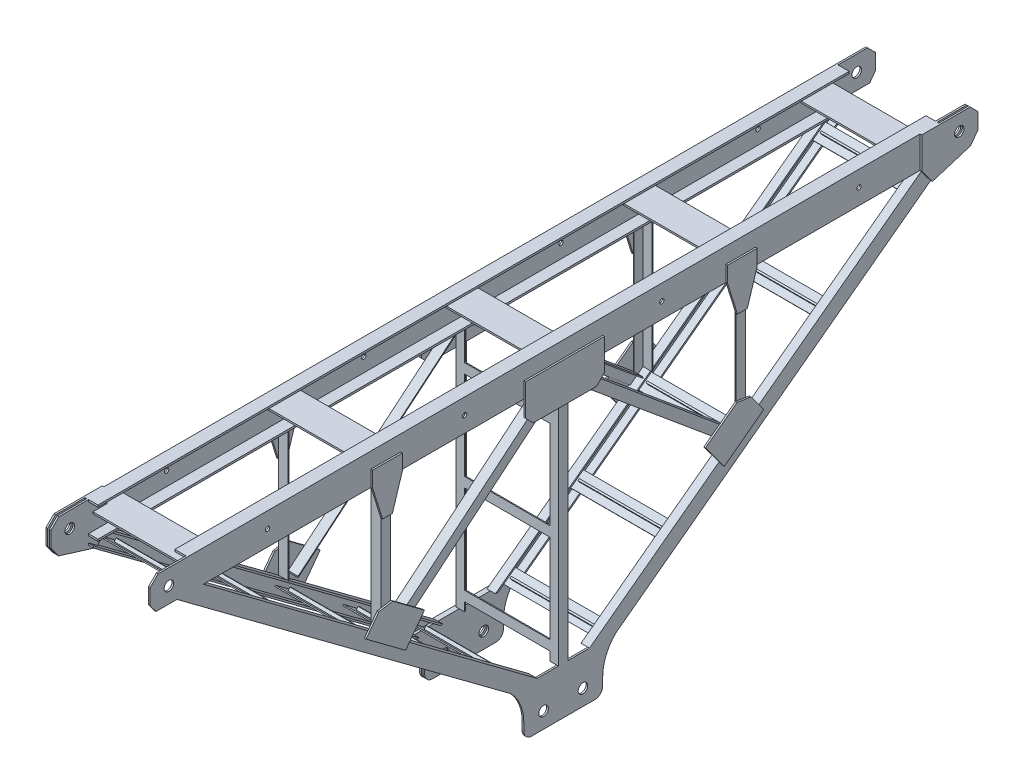
from build123d import *

# Parameters (mm, degrees)
EXTRUDE_1_DEPTH           = 4190
EXTRUDE_1_2_DEPTH         = 4190
SKETCH_7_W                = 400
SKETCH_7_H                = 240
EXTRUDE_4_DEPTH           = 520
SKETCH_8_W                = 503
SKETCH_8_H                = 400
CUT_EXTRUDE_5_DEPTH       = 4455.537012979
SKETCH_9_R                = 11
CUT_EXTRUDE_6_DEPTH       = 4481.68075185
EXTRUDE_8_DEPTH           = 43
EXTRUDE_8_2_DEPTH         = 43
CUT_EXTRUDE_9_DEPTH       = 38
EXTRUDE_10_DEPTH          = 43
EXTRUDE_10_2_DEPTH        = 43
CUT_EXTRUDE_11_DEPTH      = 38
SKETCH_17_W               = 50
SKETCH_17_H               = 1260
EXTRUDE_12_DEPTH          = 520
EXTRUDE_12_2_DEPTH        = 520
EXTRUDE_12_3_DEPTH        = 520
CUT_EXTRUDE_13_DEPTH      = 1260
SKETCH_22_W               = 390
SKETCH_22_H               = 1000
CUT_EXTRUDE_14_DEPTH      = 3412.861661908
SKETCH_23_W               = 50
SKETCH_23_H               = 707.63301644
CUT_EXTRUDE_15_DEPTH      = 15
SKETCH_25_W               = 50
SKETCH_25_H               = 707.63301644
CUT_EXTRUDE_16_DEPTH      = 15
CUT_EXTRUDE_17_DEPTH      = 45
CUT_EXTRUDE_18_DEPTH      = 45
EXTRUDE_19_DEPTH          = 50
CUT_EXTRUDE_20_DEPTH      = 45
EXTRUDE_21_DEPTH          = 50
CUT_EXTRUDE_22_DEPTH      = 45
SKETCH_32_W               = 400
SKETCH_32_H               = 200
EXTRUDE_23_DEPTH          = 8.5
PATTERN_LINEAR_7_COUNT    = 2
PATTERN_LINEAR_7_PITCH    = 528.5
EXTRUDE_24_DEPTH          = 520
PATTERN_LINEAR_8_COUNT    = 5
PATTERN_LINEAR_8_PITCH    = 900
EXTRUDE_25_DEPTH          = 512
SKETCH_35_W               = 440
SKETCH_35_H               = 8.5
EXTRUDE_26_DEPTH          = 15
PATTERN_LINEAR_9_COUNT    = 3
PATTERN_LINEAR_9_PITCH    = 430
PATTERN_LINEAR_10_COUNT   = 3
PATTERN_LINEAR_10_PITCH   = 550
MIRROR_13_COPY_1_DEPTH    = 512
MIRROR_13_COPY_2_DEPTH    = 512
MIRROR_13_COPY_3_SKETCH_W = 440
MIRROR_13_COPY_3_SKETCH_H = 8.5
MIRROR_13_COPY_3_DEPTH    = 15
MIRROR_13_COPY_4_SKETCH_W = 440
MIRROR_13_COPY_4_SKETCH_H = 8.5
MIRROR_13_COPY_4_DEPTH    = 15
MIRROR_13_COPY_5_DEPTH    = 512
MIRROR_13_COPY_6_DEPTH    = 512
MIRROR_13_COPY_7_SKETCH_W = 440
MIRROR_13_COPY_7_SKETCH_H = 8.5
MIRROR_13_COPY_7_DEPTH    = 15
MIRROR_13_COPY_8_SKETCH_W = 440
MIRROR_13_COPY_8_SKETCH_H = 8.5
MIRROR_13_COPY_8_DEPTH    = 15
SKETCH_36_W               = 50
SKETCH_36_H               = 50
EXTRUDE_27_DEPTH          = 520
SKETCH_37_W               = 510
SKETCH_37_H               = 45
CUT_EXTRUDE_28_DEPTH      = 45
PATTERN_LINEAR_11_COUNT   = 2
PATTERN_LINEAR_11_PITCH   = 500
PATTERN_LINEAR_13_COUNT   = 2
PATTERN_LINEAR_13_PITCH   = 500
SKETCH_38_W               = 503
SKETCH_38_H               = 190
CUT_EXTRUDE_29_DEPTH      = 4538.732060182
EXTRUDE_30_DEPTH          = 8.5
PATTERN_LINEAR_14_COUNT   = 2
PATTERN_LINEAR_14_PITCH   = 17
SKETCH_41_W               = 8.5
SKETCH_41_H               = 190
CUT_EXTRUDE_31_DEPTH      = 4538.732060182
SKETCH_42_R               = 24.25
CUT_EXTRUDE_32_DEPTH      = 4483.68546744
EXTRUDE_33_DEPTH          = 8.5
PATTERN_LINEAR_15_COUNT   = 2
PATTERN_LINEAR_15_PITCH   = 17
SKETCH_44_W               = 8.5
SKETCH_44_H               = 190
CUT_EXTRUDE_34_DEPTH      = 160
SKETCH_45_R               = 24.25
CUT_EXTRUDE_35_DEPTH      = 4483.68546744
CHAMFER_1_SIZE            = 50
EXTRUDE_37_DEPTH          = 8.5
PATTERN_LINEAR_16_COUNT   = 3
PATTERN_LINEAR_16_PITCH   = 8.5
SKETCH_48_W               = 8.5
SKETCH_48_H               = 600
CUT_EXTRUDE_38_DEPTH      = 160
EXTRUDE_39_DEPTH          = 8.5
FILLET_2_R                = 40
SKETCH_50_R               = 24.25
CUT_EXTRUDE_40_DEPTH      = 4483.68546744
SKETCH_51_W               = 494.5
SKETCH_51_H               = 1000
CUT_EXTRUDE_41_DEPTH      = 4456.537257167
CHAMFER_2_SIZE            = 40
SKETCH_52_R               = 11
CUT_EXTRUDE_42_DEPTH      = 4482.675161142
PATTERN_LINEAR_17_COUNT   = 4
PATTERN_LINEAR_17_PITCH   = 1000
CUT_EXTRUDE_43_DEPTH      = 4483.68546744


with BuildPart() as part:
    # 草图2 → 拉伸1 (new body)
    with BuildSketch(Plane.XY):
        Polygon((0, 0), (0, 160), (65, 160), (65, 150), (8.5, 150), (8.5, 10), (65, 10), (65, 0), align=None)
    extrude(amount=EXTRUDE_1_DEPTH)



with BuildPart() as body_2:
    # 草图2 → Extrude 1 2 (new body)
    with BuildSketch(Plane.XY):
        Polygon((455, 160), (520, 160), (520, 0), (455, 0), (455, 10), (511.5, 10), (511.5, 150), (455, 150), align=None)
    extrude(amount=EXTRUDE_1_2_DEPTH)



with BuildPart() as body_3:
    # 草图7 → 拉伸4 (new body)
    with BuildSketch(Plane(origin=(520, 0, 0), x_dir=(0, 0, -1), z_dir=(1, 0, 0))):
        with Locations((-2095, -1380)):
            Rectangle(SKETCH_7_W, SKETCH_7_H)
    extrude(amount=-EXTRUDE_4_DEPTH)

    # 草图8 → 拉伸5 (cut, through all)
    with BuildSketch(Plane(origin=(0, -1260, 0), x_dir=(1, 0, 0), z_dir=(0, 1, 0))):
        with Locations((260, -2095)):
            Rectangle(SKETCH_8_W, SKETCH_8_H)
    extrude(amount=-CUT_EXTRUDE_5_DEPTH, mode=Mode.SUBTRACT)


with BuildPart() as cut_extrude_5_piece_1:
    # of the separate pieces the step leaves, piece 1, a body of its own (cut_extrude_5_pieces)
    add(body_3.part.solids().sort_by_distance((8.5, -1260, 2295))[0])


with BuildPart() as cut_extrude_5_piece_2:
    # of the separate pieces the step leaves, piece 2, a body of its own (cut_extrude_5_pieces)
    add(body_3.part.solids().sort_by_distance((520, -1260, 2295))[0])


with BuildPart() as cut_extrude_6_tool:
    # 草图9 → 拉伸6 (new, through all)
    with BuildSketch(Plane(origin=(520, 0, 0), x_dir=(0, 0, -1), z_dir=(1, 0, 0))):
        with Locations((-2195, -1420)):
            Circle(SKETCH_9_R)
        with Locations((-1995, -1420)):
            Circle(SKETCH_9_R)
    extrude(amount=-CUT_EXTRUDE_6_DEPTH)


with BuildPart() as cut_extrude_5_piece_1_1:
    add(cut_extrude_5_piece_1.part)

    # 拉伸6: cut by cut_extrude_6_tool
    add(cut_extrude_6_tool.part, mode=Mode.SUBTRACT)


with BuildPart() as cut_extrude_5_piece_2_1:
    add(cut_extrude_5_piece_2.part)

    # 拉伸6: cut by cut_extrude_6_tool
    add(cut_extrude_6_tool.part, mode=Mode.SUBTRACT)


with BuildPart() as body_5:
    # 草图13 → 拉伸8 (new body)
    with BuildSketch(Plane(origin=(520, 0, 0), x_dir=(0, 0, -1), z_dir=(1, 0, 0))):
        Polygon((-1961.985500305, -1260), (-1895, -1260), (-1895, -1309.86698356), (-135.477186263, 0), (-269.448186872, 0), align=None)
    extrude(amount=-EXTRUDE_8_DEPTH)


with BuildPart() as body_6:
    # 草图13 → Extrude 8 2 (new body)
    with BuildSketch(Plane(origin=(520, 0, 0), x_dir=(0, 0, -1), z_dir=(1, 0, 0))):
        Polygon((-2228.014499695, -1260), (-2295, -1260), (-2295, -1309.86698356), (-4054.522813737, 0), (-3920.551813128, 0), align=None)
    extrude(amount=-EXTRUDE_8_2_DEPTH)


with BuildPart() as cut_extrude_9_tool:
    # 草图14 → 拉伸9 (new body)
    with BuildSketch(Plane.ZY.offset(-477)):
        Polygon((3933.948913189, 0), (4041.125713677, 0), (2295, -1299.893586848), (2295, -1260), (2241.411599756, -1260), align=None)
        Polygon((148.874286323, 0), (256.051086811, 0), (1948.588400244, -1260), (1895, -1260), (1895, -1299.893586848), align=None)
    extrude(amount=-CUT_EXTRUDE_9_DEPTH)


with BuildPart() as body_5_1:
    add(body_5.part)

    # 拉伸9: cut by cut_extrude_9_tool
    add(cut_extrude_9_tool.part, mode=Mode.SUBTRACT)


with BuildPart() as body_6_1:
    add(body_6.part)

    # 拉伸9: cut by cut_extrude_9_tool
    add(cut_extrude_9_tool.part, mode=Mode.SUBTRACT)


with BuildPart() as body_7:
    # 草图15 → 拉伸10 (new body)
    with BuildSketch(Plane.ZY):
        Polygon((3920.551813128, 0), (4054.522813737, 0), (2295, -1309.86698356), (2295, -1260), (2228.014499695, -1260), align=None)
    extrude(amount=-EXTRUDE_10_DEPTH)


with BuildPart() as body_8:
    # 草图15 → Extrude 10 2 (new body)
    with BuildSketch(Plane.ZY):
        Polygon((135.477186263, 0), (269.448186872, 0), (1961.985500305, -1260), (1895, -1260), (1895, -1309.86698356), align=None)
    extrude(amount=-EXTRUDE_10_2_DEPTH)


with BuildPart() as cut_extrude_11_tool:
    # 草图16 → 拉伸11 (new body)
    with BuildSketch(Plane(origin=(43, 0, 0), x_dir=(0, 0, -1), z_dir=(1, 0, 0))):
        Polygon((-3933.948913189, 0), (-4041.125713677, 0), (-2295, -1299.893586848), (-2295, -1260), (-2241.411599756, -1260), align=None)
        Polygon((-256.051086811, 0), (-148.874286323, 0), (-1895, -1299.893586848), (-1895, -1260), (-1948.588400244, -1260), align=None)
    extrude(amount=-CUT_EXTRUDE_11_DEPTH)


with BuildPart() as body_7_1:
    add(body_7.part)

    # 拉伸11: cut by cut_extrude_11_tool
    add(cut_extrude_11_tool.part, mode=Mode.SUBTRACT)


with BuildPart() as body_8_1:
    add(body_8.part)

    # 拉伸11: cut by cut_extrude_11_tool
    add(cut_extrude_11_tool.part, mode=Mode.SUBTRACT)


with BuildPart() as body_9:
    # 草图17 → 拉伸12 (new body)
    with BuildSketch(Plane.ZY):
        with Locations((2095, -630)):
            Rectangle(SKETCH_17_W, SKETCH_17_H)
    extrude(amount=-EXTRUDE_12_DEPTH)

    # 草图18 → 拉伸13 (cut)
    with BuildSketch(Plane.XZ.offset(1260)):
        Polygon((5, 2115), (43, 2115), (43, 2120), (477, 2120), (477, 2115), (515, 2115), (515, 2070), (5, 2070), align=None)
    extrude(amount=-CUT_EXTRUDE_13_DEPTH, mode=Mode.SUBTRACT)


with BuildPart() as body_10:
    # 草图17 → Extrude 12 2 (new body)
    with BuildSketch(Plane.ZY):
        Polygon((2970, 0), (2970, -707.63301644), (3020, -670.410794218), (3020, 0), align=None)
    extrude(amount=-EXTRUDE_12_2_DEPTH)


with BuildPart() as body_11:
    # 草图17 → Extrude 12 3 (new body)
    with BuildSketch(Plane.ZY):
        Polygon((1170, 0), (1170, -670.410794218), (1220, -707.63301644), (1220, 0), align=None)
    extrude(amount=-EXTRUDE_12_3_DEPTH)


with BuildPart() as cut_extrude_13_piece_1:
    # of the separate pieces the step leaves, piece 1, a body of its own (cut_extrude_13_pieces)
    add(body_9.part.solids().sort_by_distance((515, 0, 2115))[0])


with BuildPart() as cut_extrude_13_piece_2:
    # of the separate pieces the step leaves, piece 2, a body of its own (cut_extrude_13_pieces)
    add(body_9.part.solids().sort_by_distance((0, 0, 2070))[0])


with BuildPart() as cut_extrude_14_tool:
    # 草图22 → 拉伸14 (new, through all)
    with BuildSketch(Plane.XY.offset(3020)):
        with Locations((260, -500)):
            Rectangle(SKETCH_22_W, SKETCH_22_H)
    extrude(amount=-CUT_EXTRUDE_14_DEPTH)


with BuildPart() as body_10_1:
    add(body_10.part)

    # 拉伸14: cut by cut_extrude_14_tool
    add(cut_extrude_14_tool.part, mode=Mode.SUBTRACT)


with BuildPart() as body_11_1:
    add(body_11.part)

    # 拉伸14: cut by cut_extrude_14_tool
    add(cut_extrude_14_tool.part, mode=Mode.SUBTRACT)


with BuildPart() as cut_extrude_14_piece_1:
    # of the separate pieces the step leaves, piece 1, a body of its own (cut_extrude_14_pieces)
    add(body_10_1.part.solids().sort_by_distance((0, 0, 2970))[0])


with BuildPart() as cut_extrude_14_piece_2:
    # of the separate pieces the step leaves, piece 2, a body of its own (cut_extrude_14_pieces)
    add(body_10_1.part.solids().sort_by_distance((455, -707.63301644, 2970))[0])


with BuildPart() as cut_extrude_14_piece_1_of_body_11:
    # of the separate pieces the step leaves, piece 1, a body of its own (cut_extrude_14_pieces_of_body_11)
    add(body_11_1.part.solids().sort_by_distance((0, 0, 1170))[0])


with BuildPart() as cut_extrude_14_piece_2_of_body_11:
    # of the separate pieces the step leaves, piece 2, a body of its own (cut_extrude_14_pieces_of_body_11)
    add(body_11_1.part.solids().sort_by_distance((455, -670.410794218, 1170))[0])


with BuildPart() as cut_extrude_15_tool:
    # 草图23 → 拉伸15 (new body)
    with BuildSketch(Plane.ZY.offset(-455)):
        with Locations((1195, -353.81650822)):
            Rectangle(SKETCH_23_W, SKETCH_23_H)
        with Locations((2995, -353.81650822)):
            Rectangle(SKETCH_23_W, SKETCH_23_H)
    extrude(amount=-CUT_EXTRUDE_15_DEPTH)


with BuildPart() as cut_extrude_14_piece_2_1:
    add(cut_extrude_14_piece_2.part)

    # 拉伸15: cut by cut_extrude_15_tool
    add(cut_extrude_15_tool.part, mode=Mode.SUBTRACT)


with BuildPart() as cut_extrude_14_piece_2_of_body_11_1:
    add(cut_extrude_14_piece_2_of_body_11.part)

    # 拉伸15: cut by cut_extrude_15_tool
    add(cut_extrude_15_tool.part, mode=Mode.SUBTRACT)


with BuildPart() as cut_extrude_16_tool:
    # 草图25 → 拉伸16 (new body)
    with BuildSketch(Plane(origin=(65, 0, 0), x_dir=(0, 0, -1), z_dir=(1, 0, 0))):
        with Locations((-2995, -353.81650822)):
            Rectangle(SKETCH_25_W, SKETCH_25_H)
        with Locations((-1195, -353.81650822)):
            Rectangle(SKETCH_25_W, SKETCH_25_H)
    extrude(amount=-CUT_EXTRUDE_16_DEPTH)


with BuildPart() as cut_extrude_14_piece_1_1:
    add(cut_extrude_14_piece_1.part)

    # 拉伸16: cut by cut_extrude_16_tool
    add(cut_extrude_16_tool.part, mode=Mode.SUBTRACT)


with BuildPart() as cut_extrude_14_piece_1_of_body_11_1:
    add(cut_extrude_14_piece_1_of_body_11.part)

    # 拉伸16: cut by cut_extrude_16_tool
    add(cut_extrude_16_tool.part, mode=Mode.SUBTRACT)


with BuildPart() as cut_extrude_17_tool:
    # 草图26 → 拉伸17 (new body)
    with BuildSketch(Plane(origin=(50, 0, 0), x_dir=(0, 0, -1), z_dir=(1, 0, 0))):
        Polygon((-3015, 0), (-2970, 0), (-2970, -707.63301644), (-3015, -674.13301644), align=None)
        Polygon((-1175, 0), (-1220, 0), (-1220, -707.63301644), (-1175, -674.13301644), align=None)
    extrude(amount=-CUT_EXTRUDE_17_DEPTH)


with BuildPart() as cut_extrude_14_piece_1_2:
    add(cut_extrude_14_piece_1_1.part)

    # 拉伸17: cut by cut_extrude_17_tool
    add(cut_extrude_17_tool.part, mode=Mode.SUBTRACT)


with BuildPart() as cut_extrude_14_piece_1_of_body_11_2:
    add(cut_extrude_14_piece_1_of_body_11_1.part)

    # 拉伸17: cut by cut_extrude_17_tool
    add(cut_extrude_17_tool.part, mode=Mode.SUBTRACT)


with BuildPart() as cut_extrude_18_tool:
    # 草图27 → 拉伸18 (new body)
    with BuildSketch(Plane.ZY.offset(-470)):
        Polygon((3015, 0), (2970, 0), (2970, -707.63301644), (3015, -674.13301644), align=None)
        Polygon((1175, 0), (1220, 0), (1220, -707.63301644), (1175, -674.13301644), align=None)
    extrude(amount=-CUT_EXTRUDE_18_DEPTH)


with BuildPart() as cut_extrude_14_piece_2_2:
    add(cut_extrude_14_piece_2_1.part)

    # 拉伸18: cut by cut_extrude_18_tool
    add(cut_extrude_18_tool.part, mode=Mode.SUBTRACT)


with BuildPart() as cut_extrude_14_piece_2_of_body_11_2:
    add(cut_extrude_14_piece_2_of_body_11_1.part)

    # 拉伸18: cut by cut_extrude_18_tool
    add(cut_extrude_18_tool.part, mode=Mode.SUBTRACT)


with BuildPart() as part_1:
    add(part.part)

    add(body_7_1.part)  # 拉伸19 merges body 7

    add(body_8_1.part)  # 拉伸19 merges body 8

    add(cut_extrude_13_piece_2.part)  # 拉伸19 merges 拉伸13 piece 2

    add(cut_extrude_14_piece_1_2.part)  # 拉伸19 merges 拉伸14 piece 1

    add(cut_extrude_14_piece_1_of_body_11_2.part)  # 拉伸19 merges 拉伸14 piece 1 of body 11
    # 草图28 → 拉伸19 (add)
    with BuildSketch(Plane.ZY):
        Polygon((2120, -32.529524598), (2120, 0), (2159.074061365, 0), (2970, -675.103491842), (2970, -707.63301644), (2949.37192387, -722.989473114), align=None)
        Polygon((2030.925938635, 0), (2070, 0), (2070, -32.529524598), (1240.62807613, -722.989473114), (1220, -707.63301644), (1220, -675.103491842), align=None)
    extrude(amount=-EXTRUDE_19_DEPTH)

    # 草图29 → 拉伸20 (cut)
    with BuildSketch(Plane(origin=(50, 0, 0), x_dir=(0, 0, -1), z_dir=(1, 0, 0))):
        Polygon((-2038.740750908, 0), (-2070, 0), (-2070, -32.529524598), (-1240.62807613, -722.989473114), (-1220, -707.63301644), (-1220, -681.609396762), align=None)
        Polygon((-2151.259249092, 0), (-2120, 0), (-2120, -32.529524598), (-2949.37192387, -722.989473114), (-2970, -707.63301644), (-2970, -681.609396762), align=None)
    extrude(amount=-CUT_EXTRUDE_20_DEPTH, mode=Mode.SUBTRACT)

    # 草图32 → 拉伸23 (add)
    with BuildSketch(Plane.ZY):
        Polygon((1120, 80), (1270, 80), (1270, 0), (1220, -160), (1170, -160), (1120, 0), align=None)
        with Locations((2095, -20)):
            Rectangle(SKETCH_32_W, SKETCH_32_H)
        Polygon((2920, 80), (3070, 80), (3070, 0), (3020, -160), (2970, -160), (2920, 0), align=None)
        Polygon((2807.685821085, -666.399208617), (3008.21930609, -517.11316978), (3103.762370946, -645.454600184), (2903.228885941, -794.740639021), align=None)
        Polygon((1181.78069391, -517.11316978), (1382.314178915, -666.399208617), (1286.771114059, -794.740639021), (1086.237629054, -645.454600184), align=None)
    extrude_23 = extrude(amount=EXTRUDE_23_DEPTH)



with BuildPart() as body_2_1:
    add(body_2.part)

    add(body_5_1.part)  # 拉伸21 merges body 5

    add(body_6_1.part)  # 拉伸21 merges body 6

    add(cut_extrude_13_piece_1.part)  # 拉伸21 merges 拉伸13 piece 1

    add(cut_extrude_14_piece_2_2.part)  # 拉伸21 merges 拉伸14 piece 2

    add(cut_extrude_14_piece_2_of_body_11_2.part)  # 拉伸21 merges 拉伸14 piece 2 of body 11
    # 草图30 → 拉伸21 (add)
    with BuildSketch(Plane(origin=(520, 0, 0), x_dir=(0, 0, -1), z_dir=(1, 0, 0))):
        Polygon((-2070, 0), (-2030.925938635, 0), (-1220, -675.103491842), (-1220, -707.63301644), (-1240.62807613, -722.989473114), (-2070, -32.529524598), align=None)
        Polygon((-2120, 0), (-2120, -32.529524598), (-2949.37192387, -722.989473114), (-2970, -707.63301644), (-2970, -675.103491842), (-2159.074061365, 0), align=None)
    extrude(amount=-EXTRUDE_21_DEPTH)

    # 草图31 → 拉伸22 (cut)
    with BuildSketch(Plane.ZY.offset(-470)):
        Polygon((2120, 0), (2151.259249092, 0), (2970, -681.609396762), (2970, -707.63301644), (2949.37192387, -722.989473114), (2120, -32.529524598), align=None)
        Polygon((2038.740750908, 0), (2070, 0), (2070, -32.529524598), (1240.62807613, -722.989473114), (1220, -707.63301644), (1220, -681.609396762), align=None)
    extrude(amount=-CUT_EXTRUDE_22_DEPTH, mode=Mode.SUBTRACT)

    # 阵列(线性)7: 拉伸23 ×2
    with Locations(*[(i * PATTERN_LINEAR_7_PITCH, 0, 0) for i in range(1, PATTERN_LINEAR_7_COUNT)]):
        add(extrude_23)


with BuildPart() as part_2:
    add(part_1.part)

    add(body_2_1.part)  # 拉伸24 merges body 2
    # 草图33 → 拉伸24 (add)
    with BuildSketch(Plane.ZY):
        Polygon((217.5, 86.5), (293.25, 86.5), (293.25, 46.5), (301.75, 46.5), (301.75, 86.5), (377.5, 86.5), (377.5, 95), (217.5, 95), align=None)
    extrude_24 = extrude(amount=-EXTRUDE_24_DEPTH)

    # 阵列(线性)8: 拉伸24 ×5
    with Locations(*[(0, 0, i * PATTERN_LINEAR_8_PITCH) for i in range(1, PATTERN_LINEAR_8_COUNT)]):
        add(extrude_24)

    # 草图34 → 拉伸25 (add)
    with BuildSketch(Plane.ZY):
        Polygon((2975.888852008, -749.999390366), (2978.874572784, -754.010060066), (3043.045287986, -706.238527638), (3040.059567209, -702.227857938), align=None)
    extrude_25 = extrude(amount=-EXTRUDE_25_DEPTH)

    # 草图35 → 拉伸26 (add)
    with BuildSketch(Plane(origin=(0, -1907.98354433, 1420.387749668), x_dir=(1, 0, 0), z_dir=(0, 0.8021339400205776, -0.59714415534866))):
        with Locations((260, -1977.453697452)):
            Rectangle(SKETCH_35_W, SKETCH_35_H)
    extrude_26 = extrude(amount=EXTRUDE_26_DEPTH)

    # 阵列(线性)9: 拉伸25, 拉伸26 ×3
    with Locations(*[Vector(0, -0.5971441553486468, -0.8021339400205874) * (i * PATTERN_LINEAR_9_PITCH) for i in range(1, PATTERN_LINEAR_9_COUNT)]):
        add(extrude_25)
        add(extrude_26)

    # 阵列(线性)10: 拉伸25, 拉伸26 ×3
    with Locations(*[Vector(0, 0.5971441553486466, 0.8021339400205875) * (i * PATTERN_LINEAR_10_PITCH) for i in range(1, PATTERN_LINEAR_10_COUNT)]):
        add(extrude_25)
        add(extrude_26)

    # 镜向13: 拉伸25, 拉伸26 across plane
    add(extrude_25.mirror(Plane.XY.offset(2095)))
    add(extrude_26.mirror(Plane.XY.offset(2095)))

    # 镜向13 copy 1 sketch → 镜向13 copy 1 (add)
    with BuildSketch(Plane(origin=(0, -256.7719868, 4534.917594209), x_dir=(0, 0, -1), z_dir=(-1, 0, 0))):
        Polygon((2975.888852008, 749.999390366), (2978.874572784, 754.010060066), (3043.045287986, 706.238527638), (3040.059567209, 702.227857938), align=None)
    extrude(amount=-MIRROR_13_COPY_1_DEPTH)

    # 镜向13 copy 2 sketch → 镜向13 copy 2 (add)
    with BuildSketch(Plane(origin=(0, -513.5439736, 4879.835188418), x_dir=(0, 0, -1), z_dir=(-1, 0, 0))):
        Polygon((2975.888852008, 749.999390366), (2978.874572784, 754.010060066), (3043.045287986, 706.238527638), (3040.059567209, 702.227857938), align=None)
    extrude(amount=-MIRROR_13_COPY_2_DEPTH)

    # 镜向13 copy 3 sketch → 镜向13 copy 3 (add)
    with BuildSketch(Plane(origin=(0, -2164.75553113, 3114.529844541), x_dir=(1, 0, 0), z_dir=(0, 0.8021339400205776, 0.59714415534866))):
        with Locations((260, 1977.453697452)):
            Rectangle(MIRROR_13_COPY_3_SKETCH_W, MIRROR_13_COPY_3_SKETCH_H)
    extrude(amount=MIRROR_13_COPY_3_DEPTH)

    # 镜向13 copy 4 sketch → 镜向13 copy 4 (add)
    with BuildSketch(Plane(origin=(0, -2421.52751793, 3459.44743875), x_dir=(1, 0, 0), z_dir=(0, 0.8021339400205776, 0.59714415534866))):
        with Locations((260, 1977.453697452)):
            Rectangle(MIRROR_13_COPY_4_SKETCH_W, MIRROR_13_COPY_4_SKETCH_H)
    extrude(amount=MIRROR_13_COPY_4_DEPTH)

    # 镜向13 copy 5 sketch → 镜向13 copy 5 (add)
    with BuildSketch(Plane(origin=(0, 328.429285442, 3748.826332989), x_dir=(0, 0, -1), z_dir=(-1, 0, 0))):
        Polygon((2975.888852008, 749.999390366), (2978.874572784, 754.010060066), (3043.045287986, 706.238527638), (3040.059567209, 702.227857938), align=None)
    extrude(amount=-MIRROR_13_COPY_5_DEPTH)

    # 镜向13 copy 6 sketch → 镜向13 copy 6 (add)
    with BuildSketch(Plane(origin=(0, 656.858570884, 3307.652665977), x_dir=(0, 0, -1), z_dir=(-1, 0, 0))):
        Polygon((2975.888852008, 749.999390366), (2978.874572784, 754.010060066), (3043.045287986, 706.238527638), (3040.059567209, 702.227857938), align=None)
    extrude(amount=-MIRROR_13_COPY_6_DEPTH)

    # 镜向13 copy 7 sketch → 镜向13 copy 7 (add)
    with BuildSketch(Plane(origin=(0, -1579.554258888, 2328.438583321), x_dir=(1, 0, 0), z_dir=(0, 0.8021339400205776, 0.59714415534866))):
        with Locations((260, 1977.453697452)):
            Rectangle(MIRROR_13_COPY_7_SKETCH_W, MIRROR_13_COPY_7_SKETCH_H)
    extrude(amount=MIRROR_13_COPY_7_DEPTH)

    # 镜向13 copy 8 sketch → 镜向13 copy 8 (add)
    with BuildSketch(Plane(origin=(0, -1251.124973447, 1887.264916309), x_dir=(1, 0, 0), z_dir=(0, 0.8021339400205776, 0.59714415534866))):
        with Locations((260, 1977.453697452)):
            Rectangle(MIRROR_13_COPY_8_SKETCH_W, MIRROR_13_COPY_8_SKETCH_H)
    extrude(amount=MIRROR_13_COPY_8_DEPTH)

    # 草图36 → 拉伸27 (add)
    with BuildSketch(Plane(origin=(520, 0, 0), x_dir=(0, 0, -1), z_dir=(1, 0, 0))):
        with Locations((-2095, -690)):
            Rectangle(SKETCH_36_W, SKETCH_36_H)
    extrude_27 = extrude(amount=-EXTRUDE_27_DEPTH)

    # 草图37 → 拉伸28 (cut)
    with BuildSketch(Plane(origin=(0, -665, 0), x_dir=(1, 0, 0), z_dir=(0, 1, 0))):
        with Locations((260, -2092.5)):
            Rectangle(SKETCH_37_W, SKETCH_37_H)
    cut_extrude_28 = extrude(amount=-CUT_EXTRUDE_28_DEPTH, mode=Mode.SUBTRACT)

    # 阵列(线性)11: 拉伸27, 拉伸28 ×2
    with Locations(*[(0, i * PATTERN_LINEAR_11_PITCH, 0) for i in range(1, PATTERN_LINEAR_11_COUNT)]):
        add(extrude_27)
        add(cut_extrude_28, mode=Mode.SUBTRACT)

    # 阵列(线性)13: 拉伸27, 拉伸28 ×2
    with Locations(*[(0, -i * PATTERN_LINEAR_13_PITCH, 0) for i in range(1, PATTERN_LINEAR_13_COUNT)]):
        add(extrude_27)
        add(cut_extrude_28, mode=Mode.SUBTRACT)

    # 草图38 → 拉伸29 (cut, through all)
    with BuildSketch(Plane(origin=(0, 160, 0), x_dir=(1, 0, 0), z_dir=(0, 1, 0))):
        with Locations((260, -95)):
            Rectangle(SKETCH_38_W, SKETCH_38_H)
        with Locations((260, -4095)):
            Rectangle(SKETCH_38_W, SKETCH_38_H)
    extrude(amount=-CUT_EXTRUDE_29_DEPTH, mode=Mode.SUBTRACT)

    # 草图39 → 拉伸30 (add)
    with BuildSketch(Plane(origin=(520, 0, 0), x_dir=(0, 0, -1), z_dir=(1, 0, 0))):
        Polygon((-285, 160), (0, 160), (0, 0), (-231.682984283, -71.619871859), (-285, 0), align=None)
    extrude_30 = extrude(amount=EXTRUDE_30_DEPTH)

    # 阵列(线性)14: 拉伸30 ×2
    with Locations(*[(-i * PATTERN_LINEAR_14_PITCH, 0, 0) for i in range(1, PATTERN_LINEAR_14_COUNT)]):
        add(extrude_30)

    # 草图41 → 拉伸31 (cut, through all)
    with BuildSketch(Plane(origin=(0, 160, 0), x_dir=(1, 0, 0), z_dir=(0, 1, 0))):
        with Locations((515.75, -95)):
            Rectangle(SKETCH_41_W, SKETCH_41_H)
    extrude(amount=-CUT_EXTRUDE_31_DEPTH, mode=Mode.SUBTRACT)

    # 草图42 → 拉伸32 (cut, through all)
    with BuildSketch(Plane(origin=(528.5, 0, 0), x_dir=(0, 0, -1), z_dir=(1, 0, 0))):
        with Locations((-95, 80)):
            Circle(SKETCH_42_R)
    extrude(amount=-CUT_EXTRUDE_32_DEPTH, mode=Mode.SUBTRACT)

    # 草图43 → 拉伸33 (add)
    with BuildSketch(Plane.ZY):
        Polygon((3905, 160), (3905, 0), (3958.317015717, -71.619871859), (4190, 0), (4190, 160), align=None)
    extrude_33 = extrude(amount=EXTRUDE_33_DEPTH)

    # 阵列(线性)15: 拉伸33 ×2
    with Locations(*[(i * PATTERN_LINEAR_15_PITCH, 0, 0) for i in range(1, PATTERN_LINEAR_15_COUNT)]):
        add(extrude_33)

    # 草图44 → 拉伸34 (cut)
    with BuildSketch(Plane(origin=(0, 160, 0), x_dir=(1, 0, 0), z_dir=(0, 1, 0))):
        with Locations((4.25, -4095)):
            Rectangle(SKETCH_44_W, SKETCH_44_H)
    extrude(amount=-CUT_EXTRUDE_34_DEPTH, mode=Mode.SUBTRACT)

    # 草图45 → 拉伸35 (cut, through all)
    with BuildSketch(Plane.ZY.offset(8.5)):
        with Locations((4095, 80)):
            Circle(SKETCH_45_R)
    extrude(amount=-CUT_EXTRUDE_35_DEPTH, mode=Mode.SUBTRACT)

    # 倒角1
    # the kernel refuses this chamfer: 50 mm, written as the material it takes off along each edge
    with BuildSketch(Plane(origin=(0, -517.11316978, 3008.21930609), x_dir=(0, -0.574863009402028, -0.8182496687571855), z_dir=(-1, 0, 0)), Plane(origin=(0, -517.11316978, 1181.78069391), x_dir=(0, -0.7854116647287853, -0.6189737610819688), z_dir=(-1, 0, 0))) as chamfer_1_piece_1:
        Polygon((CHAMFER_1_SIZE * 0.999621916911, CHAMFER_1_SIZE * 0.0274958766106), (-CHAMFER_1_SIZE * 0.0274958766106, CHAMFER_1_SIZE * 0.999621916911), (0, 0), align=None)
    extrude(amount=137.084149398, mode=Mode.SUBTRACT)
    with BuildSketch(Plane(origin=(657.084149398, -517.11316978, 3008.21930609), x_dir=(0, -0.7854116647287853, 0.6189737610819688), z_dir=(-1, 0, 0)), Plane(origin=(657.084149398, -517.11316978, 1181.78069391), x_dir=(0, -0.5748630094020307, 0.8182496687571837), z_dir=(-1, 0, 0))) as chamfer_1_piece_2:
        Polygon((CHAMFER_1_SIZE * 0.999621916911, -CHAMFER_1_SIZE * 0.0274958766106), (-CHAMFER_1_SIZE * 0.0274958766106, -CHAMFER_1_SIZE * 0.999621916911), (0, 0), align=None)
    extrude(amount=137.084149398, mode=Mode.SUBTRACT)


    add(cut_extrude_5_piece_1_1.part)  # 拉伸37 merges 拉伸5 piece 1
    # 草图47 → 拉伸37 (add)
    with BuildSketch(Plane.ZY):
        with BuildLine():
            Line((1828.014499695, -1260), (2361.985500305, -1260))
            ThreePointArc((2361.985500305, -1260), (2312.422154247, -1333.271894332), (2295, -1420))
            Line((2295, -1420), (2295, -1500))
            Line((2295, -1500), (1895, -1500))
            Line((1895, -1500), (1895, -1420))
            ThreePointArc((1895, -1420), (1877.577845753, -1333.271894332), (1828.014499695, -1260))
        make_face()
    extrude_37 = extrude(amount=EXTRUDE_37_DEPTH)

    # 阵列(线性)16: 拉伸37 ×3
    with Locations(*[(i * PATTERN_LINEAR_16_PITCH, 0, 0) for i in range(1, PATTERN_LINEAR_16_COUNT)]):
        add(extrude_37)

    # 草图48 → 拉伸38 (cut)
    with BuildSketch(Plane.XZ.offset(1500)):
        with Locations((4.25, 2095)):
            Rectangle(SKETCH_48_W, SKETCH_48_H)
    extrude(amount=-CUT_EXTRUDE_38_DEPTH, mode=Mode.SUBTRACT)


    add(cut_extrude_5_piece_2_1.part)  # 拉伸39 merges 拉伸5 piece 2
    # 草图49 → 拉伸39 (add)
    with BuildSketch(Plane(origin=(520, 0, 0), x_dir=(0, 0, -1), z_dir=(1, 0, 0))):
        with BuildLine():
            Line((-2361.985500305, -1260), (-1828.014499695, -1260))
            ThreePointArc((-1828.014499695, -1260), (-1877.577845753, -1333.271894332), (-1895, -1420))
            Line((-1895, -1420), (-1895, -1500))
            Line((-1895, -1500), (-2295, -1500))
            Line((-2295, -1500), (-2295, -1420))
            ThreePointArc((-2295, -1420), (-2312.422154247, -1333.271894332), (-2361.985500305, -1260))
        make_face()
    extrude(amount=-EXTRUDE_39_DEPTH)

    # 圆角2
    fillet_2_edges = [part_2.edges().sort_by_distance(p)[0] for p in [
        (515.75, -1500, 2295),
        (515.75, -1500, 1895),
        (12.75, -1500, 1895),
        (12.75, -1500, 2295),
        (-4.25, -1500, 1895),
        (-4.25, -1500, 2295),
    ]]
    fillet(fillet_2_edges, radius=FILLET_2_R)

    # 草图50 → 拉伸40 (cut, through all)
    with BuildSketch(Plane.ZY.offset(8.5)):
        with Locations((1995, -1420)):
            Circle(SKETCH_50_R)
        with Locations((2195, -1420)):
            Circle(SKETCH_50_R)
    extrude(amount=-CUT_EXTRUDE_40_DEPTH, mode=Mode.SUBTRACT)

    # 草图51 → 拉伸41 (cut, through all)
    with BuildSketch(Plane.XZ.offset(1260)):
        with Locations((264.25, 2120)):
            Rectangle(SKETCH_51_W, SKETCH_51_H)
    extrude(amount=CUT_EXTRUDE_41_DEPTH, mode=Mode.SUBTRACT)

    # 倒角2
    # the kernel refuses this chamfer: 40 mm, written as the material it takes off along each edge
    with BuildSketch(Plane(origin=(631.367319519, -120, 1895), x_dir=(0, -0.027495876610586282, 0.9996219169112968), z_dir=(-1, 0, 0)), Plane(origin=(0, -120, 1895), x_dir=(0, -0.027495876610586282, 0.9996219169112968), z_dir=(-1, 0, 0))) as chamfer_2_piece_1:
        Polygon((CHAMFER_2_SIZE * 0.999621916911, CHAMFER_2_SIZE * 0.0274958766106), (-CHAMFER_2_SIZE * 0.0274958766106, CHAMFER_2_SIZE * 0.999621916911), (0, 0), align=None)
    extrude(amount=111.367319519, mode=Mode.SUBTRACT)
    with BuildSketch(Plane(origin=(0, -120, 2295), x_dir=(0, -0.02749587661058643, -0.9996219169112968), z_dir=(-1, 0, 0)), Plane(origin=(631.367319519, -120, 2295), x_dir=(0, -0.02749587661058643, -0.9996219169112968), z_dir=(-1, 0, 0))) as chamfer_2_piece_2:
        Polygon((CHAMFER_2_SIZE * 0.999621916911, -CHAMFER_2_SIZE * 0.0274958766106), (-CHAMFER_2_SIZE * 0.0274958766106, -CHAMFER_2_SIZE * 0.999621916911), (0, 0), align=None)
    extrude(amount=111.367319519, mode=Mode.SUBTRACT)

    # 草图52 → 拉伸42 (cut, through all)
    with BuildSketch(Plane(origin=(520, 0, 0), x_dir=(0, 0, -1), z_dir=(1, 0, 0))):
        with Locations((-3595, 80)):
            Circle(SKETCH_52_R)
    cut_extrude_42 = extrude(amount=-CUT_EXTRUDE_42_DEPTH, mode=Mode.SUBTRACT)

    # 阵列(线性)17: 拉伸42 ×4
    with Locations(*[(0, 0, -i * PATTERN_LINEAR_17_PITCH) for i in range(1, PATTERN_LINEAR_17_COUNT)]):
        add(cut_extrude_42, mode=Mode.SUBTRACT)

    # 草图54 → 拉伸43 (cut, through all)
    with BuildSketch(Plane.ZY.offset(8.5)):
        Polygon((4190, 160), (4190, 120), (4150, 160), align=None)
        Polygon((4190, 40), (4190, 0), (4151.78430241, -11.813570914), align=None)
        Polygon((0, 120), (40, 160), (0, 160), align=None)
        Polygon((0, 40), (38.21569759, -11.813570914), (0, 0), align=None)
    extrude(amount=-CUT_EXTRUDE_43_DEPTH, mode=Mode.SUBTRACT)


solid = part_2.part
